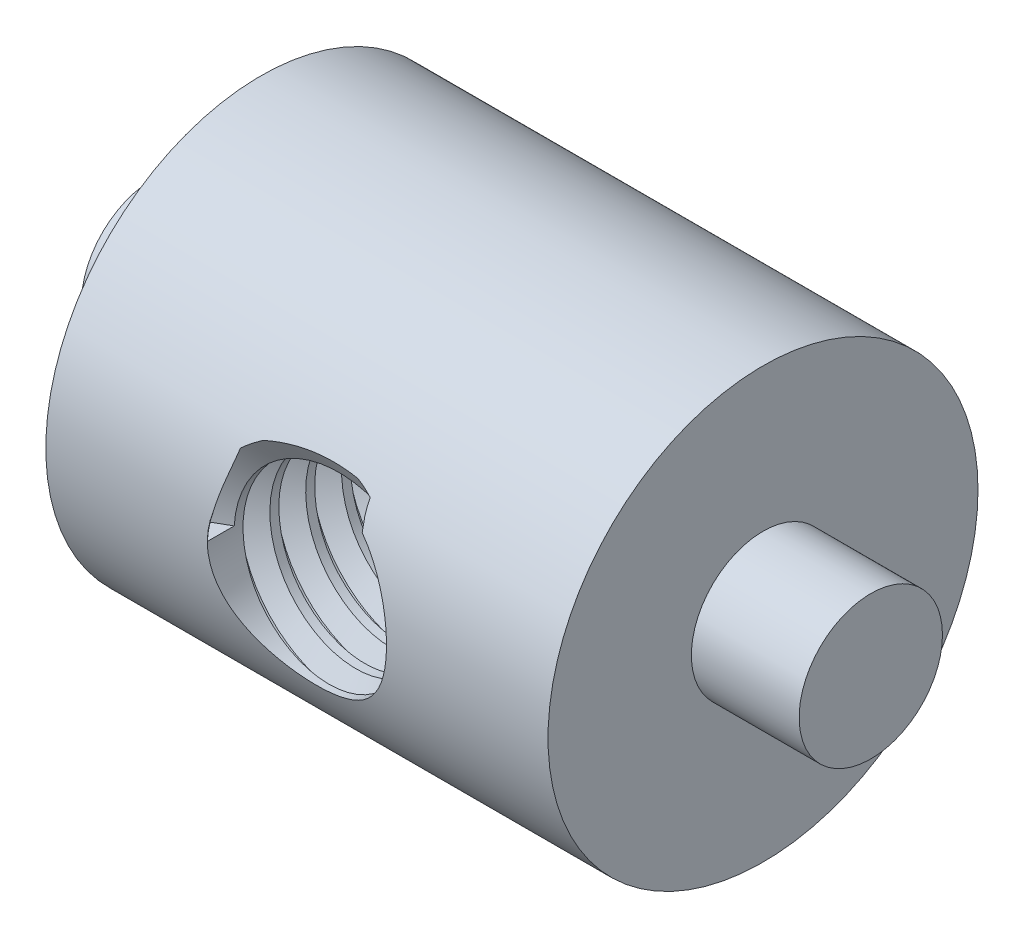
from build123d import *

# Parameters (mm, degrees)
SKETCH1_R               = 9.525
BOSS_EXTRUDE1_DEPTH     = 11.1252
SKETCH2_R               = 3.175
BOSS_EXTRUDE2_DEPTH     = 4.7752
CUT_EXTRUDE1_DEPTH      = 21.839241113
CUT_EXTRUDE1_DEPTH_BACK = 21.839241113
SKETCH5_R               = 3.96875
THREAD2_PITCH           = 1.5875


with BuildPart() as part:
    # Sketch1 → Boss-Extrude1 (new, symmetric)
    with BuildSketch(Plane(origin=(0, 0, 0), x_dir=(0, 0, -1), z_dir=(1, 0, 0))):
        with Locations(Location((0, 0, 0), (0, 0, 180))):
            Circle(SKETCH1_R)
    extrude(amount=BOSS_EXTRUDE1_DEPTH, both=True)

    # Sketch2 → Boss-Extrude2 (add)
    with BuildSketch(Plane(origin=(11.1252, 0, 0), x_dir=(0, 0, -1), z_dir=(1, 0, 0))):
        Circle(SKETCH2_R)
    boss_extrude2 = extrude(amount=BOSS_EXTRUDE2_DEPTH)

    # Mirror1: Boss-Extrude2 across plane
    add(boss_extrude2.mirror(Plane(origin=(0, 0, 0), x_dir=(0, 0, 1), z_dir=(1, 0, 0))))

    # Sketch5 → Cut-Extrude1 (cut, two sides: drawn at the far end of the back side and taken through both)
    with BuildSketch(Plane.XY.offset(-CUT_EXTRUDE1_DEPTH_BACK)):
        Circle(SKETCH5_R)
    extrude(amount=CUT_EXTRUDE1_DEPTH + CUT_EXTRUDE1_DEPTH_BACK, mode=Mode.SUBTRACT)

    # Thread2: the profile of Thread Profile4 profile screwed along a right-hand helix of 12 turns, 8 arcs to a turn; built about Z, then put on its axis
    thread2_z = Axis((0, 0, 0), (0, 0, 1))
    thread2_corners = [(3.96845, 0, -0.000173205), (4.828009577, 0, 0.496093748), (4.828009577, 0, 0.694531248), (3.96845, 0, 1.190798201)]
    with BuildLine(mode=Mode.PRIVATE) as thread2_profile:
        Line(thread2_corners[0], thread2_corners[1])
        Line(thread2_corners[1], thread2_corners[2])
        Line(thread2_corners[2], thread2_corners[3])
        Line(thread2_corners[3], thread2_corners[0])
    thread2_cap = Face(thread2_profile.wire())
    thread2_turn_angles = [0, 22.5, 45, 67.5, 90, 112.5, 135, 157.5, 180, 202.5, 225, 247.5, 270, 292.5, 315, 337.5, 360]
    thread2_turn_weights = [1, 0.9238795325112867, 1, 0.9238795325112867, 1, 0.9238795325112867, 1, 0.9238795325112867, 1, 0.9238795325112867, 1, 0.9238795325112867, 1, 0.9238795325112867, 1, 0.9238795325112867, 1]
    thread2_turn_rails = [Edge.make_bspline([Vector(p[0], p[1], 0).rotate(thread2_z, thread2_turn_angles[k]) / thread2_turn_weights[k] + Vector(0, 0, p[2] + THREAD2_PITCH * thread2_turn_angles[k] / 360) for k in range(17)], [0, 0, 0, 1, 1, 2, 2, 3, 3, 4, 4, 5, 5, 6, 6, 7, 7, 8, 8, 8], 2, thread2_turn_weights) for p in thread2_corners]
    thread2_turn_sides = [Face.make_surface_from_curves(thread2_turn_rails[p[0]], thread2_turn_rails[p[1]]) for p in [(0, 1), (1, 2), (2, 3), (3, 0)]]
    thread2 = Plane(origin=(0, 0, 9.525), x_dir=(-1, 0, 0), z_dir=(0, 0, -1)) * Solid(Shell([*[p.moved(Location((0, 0, THREAD2_PITCH * i))) for i in range(12) for p in thread2_turn_sides], thread2_cap, thread2_cap.rotate(thread2_z, 4320).moved(Location((0, 0, THREAD2_PITCH * 4320 / 360)))]))
    add(thread2, mode=Mode.SUBTRACT)


solid = part.part
